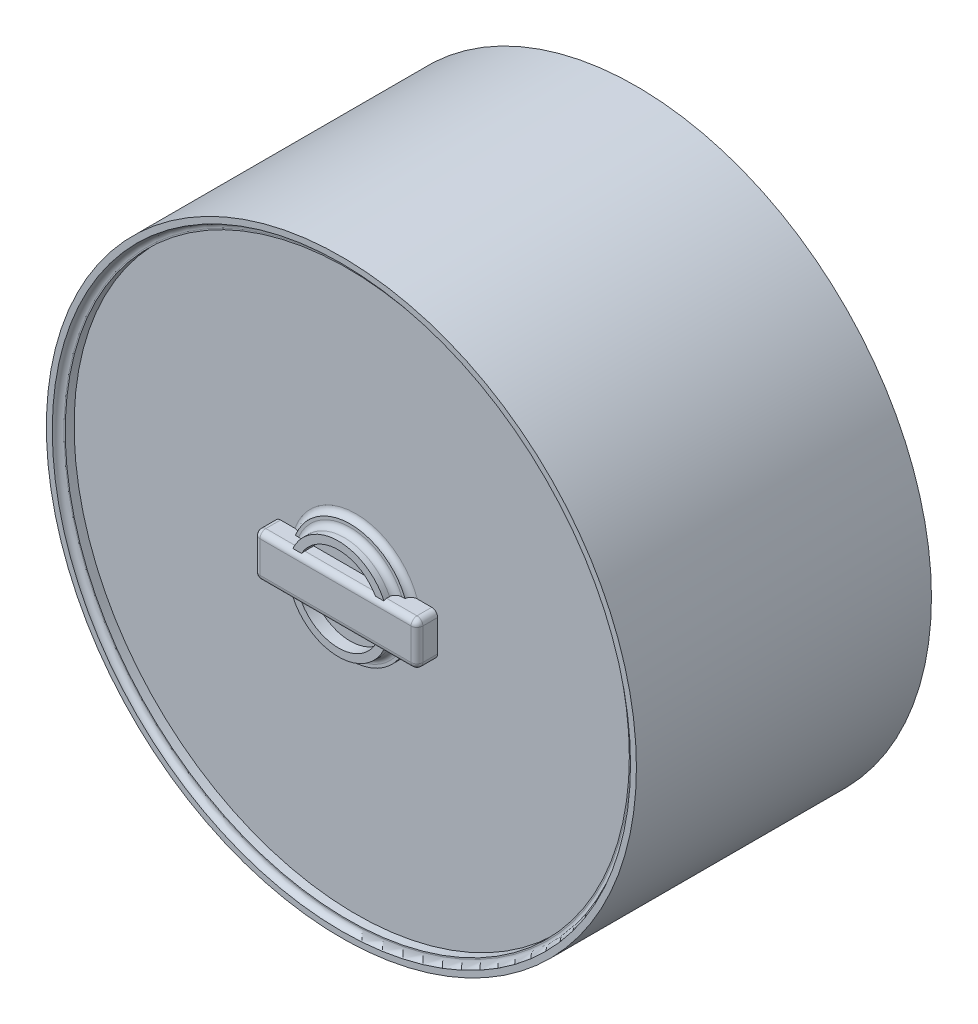
from build123d import *

# Parameters (mm, degrees)
BOSS_EXTRUDE1_DEPTH      = 250
BOSS_EXTRUDE1_DEPTH_BACK = 250
SKETCH2_R                = 500
SKETCH3_R                = 490
CUT_EXTRUDE4_DEPTH       = 10
SKETCH5_R                = 478
CUT_EXTRUDE5_DEPTH       = 15
SKETCH6_R                = 100
BOSS_EXTRUDE2_DEPTH      = 10
SKETCH7_R                = 85
BOSS_EXTRUDE3_DEPTH      = 20
SKETCH8_R                = 72
CUT_EXTRUDE6_DEPTH       = 20
FILLET2_R                = 10
SKETCH9_W                = 276.167171278
SKETCH9_H                = 73.496102034
BOSS_EXTRUDE4_DEPTH      = 40
FILLET3_R                = 10
FILLET4_R                = 10
FILLET5_R                = 10
BOSS_EXTRUDE5_START      = 10
SKETCH10_R               = 100
BOSS_EXTRUDE5_DEPTH      = 10
SCALE1_SCALE             = 0.7


# Some blends are built 0.0001 mm under size
with BuildPart() as part:
    # Sketch2 → Boss-Extrude1 (new, two sides: drawn at the far end of the back side and taken through both)
    with BuildSketch(Plane.XY.offset(-BOSS_EXTRUDE1_DEPTH_BACK)):
        Circle(SKETCH2_R)
    extrude(amount=BOSS_EXTRUDE1_DEPTH + BOSS_EXTRUDE1_DEPTH_BACK)

    # Sketch3 → Cut-Extrude4 (cut)
    with BuildSketch(Plane.XY.offset(250)):
        Circle(SKETCH3_R)
    extrude(amount=-CUT_EXTRUDE4_DEPTH, mode=Mode.SUBTRACT)

    # Sketch5 → Cut-Extrude5 (cut)
    with BuildSketch(Plane.XY.offset(240)):
        Circle(SKETCH5_R)
    extrude(amount=-CUT_EXTRUDE5_DEPTH, mode=Mode.SUBTRACT)

    # Sketch6 → Boss-Extrude2 (add)
    with BuildSketch(Plane.XY.offset(225)):
        Circle(SKETCH6_R)
    extrude(amount=BOSS_EXTRUDE2_DEPTH)

    # Sketch7 → Boss-Extrude3 (add)
    with BuildSketch(Plane.XY.offset(235)):
        Circle(SKETCH7_R)
    extrude(amount=BOSS_EXTRUDE3_DEPTH)

    # Sketch8 → Cut-Extrude6 (cut)
    with BuildSketch(Plane.XY.offset(255)):
        Circle(SKETCH8_R)
    extrude(amount=-CUT_EXTRUDE6_DEPTH, mode=Mode.SUBTRACT)

    # Fillet2
    fillet2_edges = [part.edges().sort_by_distance(p)[0] for p in [
        (-85, 0, 235),
    ]]
    fillet(fillet2_edges, radius=FILLET2_R)

    # Sketch9 → Boss-Extrude4 (add)
    with BuildSketch(Plane.XY.offset(220)):
        Rectangle(SKETCH9_W, SKETCH9_H)
    extrude(amount=BOSS_EXTRUDE4_DEPTH)

    # Fillet3
    # the kernel refuses this fillet: 10 mm, written as the material it takes off along each edge
    with BuildSketch(Plane(origin=(128.083585639, -26.748051017, 250), x_dir=(0, 0, 1), z_dir=(1, 0, 0))) as fillet3_piece_1_section:
        Polygon((0, 0), (FILLET3_R * 1.02, 0), (FILLET3_R * 1.02, FILLET3_R * 1.02), (0, FILLET3_R * 1.02), align=None)
    fillet3_piece_1 = extrude(amount=FILLET3_R * 1.02, mode=Mode.PRIVATE)
    fillet3_piece_1 = fillet3_piece_1 - Plane(origin=(128.083585639, -26.748051017, 250), x_dir=(0, 0.7071067811865475, -0.7071067811865475), z_dir=(1, 0, 0)) * Sphere(FILLET3_R, mode=Mode.PRIVATE)
    add(fillet3_piece_1, mode=Mode.SUBTRACT)
    with BuildSketch(Plane(origin=(-128.083585639, -26.748051017, 250), x_dir=(-1, 0, 0), z_dir=(0, 0, 1))) as fillet3_piece_2_section:
        Polygon((0, 0), (FILLET3_R * 1.02, 0), (FILLET3_R * 1.02, FILLET3_R * 1.02), (0, FILLET3_R * 1.02), align=None)
    fillet3_piece_2 = extrude(amount=FILLET3_R * 1.02, mode=Mode.PRIVATE)
    fillet3_piece_2 = fillet3_piece_2 - Plane(origin=(-128.083585639, -26.748051017, 250), x_dir=(0.7071067811865475, 0.7071067811865475, 0), z_dir=(0, 0, 1)) * Sphere(FILLET3_R, mode=Mode.PRIVATE)
    add(fillet3_piece_2, mode=Mode.SUBTRACT)
    with BuildSketch(Plane(origin=(-128.083585639, 26.748051017, 250), x_dir=(0, 0, 1), z_dir=(0, 1, 0))) as fillet3_piece_3_section:
        Polygon((0, 0), (FILLET3_R * 1.02, 0), (FILLET3_R * 1.02, -FILLET3_R * 1.02), (0, -FILLET3_R * 1.02), align=None)
    fillet3_piece_3 = extrude(amount=FILLET3_R * 1.02, mode=Mode.PRIVATE)
    fillet3_piece_3 = fillet3_piece_3 - Plane(origin=(-128.083585639, 26.748051017, 250), x_dir=(0.7071067811865475, 0, -0.7071067811865475), z_dir=(0, 1, 0)) * Sphere(FILLET3_R, mode=Mode.PRIVATE)
    add(fillet3_piece_3, mode=Mode.SUBTRACT)
    with BuildSketch(Plane(origin=(128.083585639, 26.748051017, 250), x_dir=(0, 1, 0), z_dir=(1, 0, 0))) as fillet3_piece_4_section:
        Polygon((0, 0), (FILLET3_R * 1.02, 0), (FILLET3_R * 1.02, FILLET3_R * 1.02), (0, FILLET3_R * 1.02), align=None)
    fillet3_piece_4 = extrude(amount=FILLET3_R * 1.02, mode=Mode.PRIVATE)
    fillet3_piece_4 = fillet3_piece_4 - Plane(origin=(128.083585639, 26.748051017, 250), x_dir=(0, -0.7071067811865475, -0.7071067811865475), z_dir=(1, 0, 0)) * Sphere(FILLET3_R, mode=Mode.PRIVATE)
    add(fillet3_piece_4, mode=Mode.SUBTRACT)
    with BuildSketch(Plane(origin=(128.083585639, -36.748051017, 260), x_dir=(0, 1, 0), z_dir=(-1, 0, 0))) as fillet3_piece_5_section:
        with BuildLine():
            CenterArc((FILLET3_R, FILLET3_R), FILLET3_R, 180, 90)
            Line((0, FILLET3_R), (0, 0))
            Line((0, 0), (FILLET3_R, 0))
        make_face()
    fillet3_piece_5 = extrude(amount=256.167171277, mode=Mode.PRIVATE)
    fillet3_piece_5 = split(fillet3_piece_5, bisect_by=Plane(origin=(102.906545957, -34.337396915, 255), z_dir=(0, 0, 1)), keep=Keep.TOP, mode=Mode.PRIVATE)
    add(fillet3_piece_5, mode=Mode.SUBTRACT)
    with BuildSketch(Plane(origin=(128.083585639, -36.748051017, 260), x_dir=(0, 1, 0), z_dir=(-1, 0, 0))) as fillet3_piece_6_section:
        with BuildLine():
            CenterArc((FILLET3_R, FILLET3_R), FILLET3_R, 180, 90)
            Line((0, FILLET3_R), (0, 0))
            Line((0, 0), (FILLET3_R, 0))
        make_face()
    fillet3_piece_6 = extrude(amount=256.167171277, mode=Mode.PRIVATE)
    fillet3_piece_6 = fillet3_piece_6 - Plane(origin=(0, 0, 253.76582848), x_dir=(1, 0, 0), z_dir=(0, 0, -1)) * Cylinder(85, 553, mode=Mode.PRIVATE)
    add(fillet3_piece_6, mode=Mode.SUBTRACT)
    with BuildSketch(Plane(origin=(128.083585639, -36.748051017, 260), x_dir=(0, 1, 0), z_dir=(-1, 0, 0))) as fillet3_piece_7_section:
        with BuildLine():
            CenterArc((FILLET3_R, FILLET3_R), FILLET3_R, 180, 90)
            Line((0, FILLET3_R), (0, 0))
            Line((0, 0), (FILLET3_R, 0))
        make_face()
    fillet3_piece_7 = extrude(amount=256.167171277, mode=Mode.PRIVATE)
    fillet3_piece_7 = fillet3_piece_7 & Plane(origin=(0, 0, 253.76892881), x_dir=(1, 0, 0), z_dir=(0, 0, 1)) * Cylinder(72, 553, mode=Mode.PRIVATE)
    add(fillet3_piece_7, mode=Mode.SUBTRACT)
    with BuildSketch(Plane(origin=(-138.083585639, -26.748051017, 260), x_dir=(1, 0, 0), z_dir=(0, 1, 0))) as fillet3_piece_8:
        with BuildLine():
            CenterArc((FILLET3_R, FILLET3_R), FILLET3_R, 180, 90)
            Line((0, FILLET3_R), (0, 0))
            Line((0, 0), (FILLET3_R, 0))
        make_face()
    extrude(amount=53.496102033, mode=Mode.SUBTRACT)
    with BuildSketch(Plane(origin=(-128.083585639, 36.748051017, 260), x_dir=(0, 0, -1), z_dir=(1, 0, 0))) as fillet3_piece_9_section:
        with BuildLine():
            CenterArc((FILLET3_R, -FILLET3_R), FILLET3_R, 90, 90)
            Line((0, -FILLET3_R), (0, 0))
            Line((0, 0), (FILLET3_R, 0))
        make_face()
    fillet3_piece_9 = extrude(amount=256.167171277, mode=Mode.PRIVATE)
    fillet3_piece_9 = fillet3_piece_9 - Plane(origin=(0, 0, 253.76582848), x_dir=(1, 0, 0), z_dir=(0, 0, -1)) * Cylinder(85, 553, mode=Mode.PRIVATE)
    add(fillet3_piece_9, mode=Mode.SUBTRACT)
    with BuildSketch(Plane(origin=(-128.083585639, 36.748051017, 260), x_dir=(0, 0, -1), z_dir=(1, 0, 0))) as fillet3_piece_10_section:
        with BuildLine():
            CenterArc((FILLET3_R, -FILLET3_R), FILLET3_R, 90, 90)
            Line((0, -FILLET3_R), (0, 0))
            Line((0, 0), (FILLET3_R, 0))
        make_face()
    fillet3_piece_10 = extrude(amount=256.167171277, mode=Mode.PRIVATE)
    fillet3_piece_10 = split(fillet3_piece_10, bisect_by=Plane(origin=(-70.492794496, 34.331084629, 255), z_dir=(0, 0, 1)), keep=Keep.TOP, mode=Mode.PRIVATE)
    add(fillet3_piece_10, mode=Mode.SUBTRACT)
    with BuildSketch(Plane(origin=(-128.083585639, 36.748051017, 260), x_dir=(0, 0, -1), z_dir=(1, 0, 0))) as fillet3_piece_11_section:
        with BuildLine():
            CenterArc((FILLET3_R, -FILLET3_R), FILLET3_R, 90, 90)
            Line((0, -FILLET3_R), (0, 0))
            Line((0, 0), (FILLET3_R, 0))
        make_face()
    fillet3_piece_11 = extrude(amount=256.167171277, mode=Mode.PRIVATE)
    fillet3_piece_11 = fillet3_piece_11 & Plane(origin=(0, 0, 253.768928808), x_dir=(1, 0, 0), z_dir=(0, 0, 1)) * Cylinder(72, 553, mode=Mode.PRIVATE)
    add(fillet3_piece_11, mode=Mode.SUBTRACT)
    with BuildSketch(Plane(origin=(138.083585639, 26.748051017, 260), x_dir=(0, 0, -1), z_dir=(0, -1, 0))) as fillet3_piece_12:
        with BuildLine():
            CenterArc((FILLET3_R, -FILLET3_R), FILLET3_R, 90, 90)
            Line((0, -FILLET3_R), (0, 0))
            Line((0, 0), (FILLET3_R, 0))
        make_face()
    extrude(amount=53.496102033, mode=Mode.SUBTRACT)
    with BuildSketch(Plane(origin=(138.083585639, 36.748051017, 225), x_dir=(-1, 0, 0), z_dir=(0, 0, 1)), Plane(origin=(138.083585639, -36.748051017, 225), x_dir=(0, 1, 0), z_dir=(0, 0, 1))) as fillet3_piece_13:
        with BuildLine():
            CenterArc((FILLET3_R, FILLET3_R), FILLET3_R, 180, 90)
            Line((0, FILLET3_R), (0, 0))
            Line((0, 0), (FILLET3_R, 0))
        make_face()
    extrude(amount=25, mode=Mode.SUBTRACT)
    with BuildSketch(Plane(origin=(-138.083585639, -36.748051017, 225), x_dir=(0, 1, 0), z_dir=(0, 0, 1)), Plane(origin=(-138.083585639, 36.748051017, 225), x_dir=(1, 0, 0), z_dir=(0, 0, 1))) as fillet3_piece_14:
        with BuildLine():
            CenterArc((FILLET3_R, -FILLET3_R), FILLET3_R, 90, 90)
            Line((0, -FILLET3_R), (0, 0))
            Line((0, 0), (FILLET3_R, 0))
        make_face()
    extrude(amount=25, mode=Mode.SUBTRACT)

    # Fillet4
    fillet4_edges = [part.edges().sort_by_distance(p)[0] for p in [
        (0, 100, 225),
    ]]
    fillet(fillet4_edges, radius=FILLET4_R - 0.0001)  # a hair under: the kernel refuses the full size

    # Fillet5
    fillet5_edges = [part.edges().sort_by_distance(p)[0] for p in [
        (-490, 0, 240),
    ]]
    fillet(fillet5_edges, radius=FILLET5_R - 0.0001)  # a hair under: the kernel refuses the full size

    # Sketch10 → Boss-Extrude5 (add)
    with BuildSketch(Plane(origin=(0, 0, -250), x_dir=(-1, 0, 0), z_dir=(0, 0, -1)).offset(BOSS_EXTRUDE5_START)):
        with Locations(Location((0, 0, 0), (0, 0, 180))):
            Circle(SKETCH10_R)
    extrude(amount=-BOSS_EXTRUDE5_DEPTH)


with BuildPart() as part_1:
    # Scale1: scaled about (0, 0.001114487, -11.134314022)
    add(part.part.scale(SCALE1_SCALE).moved(Location((0, 0.000334346, -3.340294207))))


solid = part_1.part
